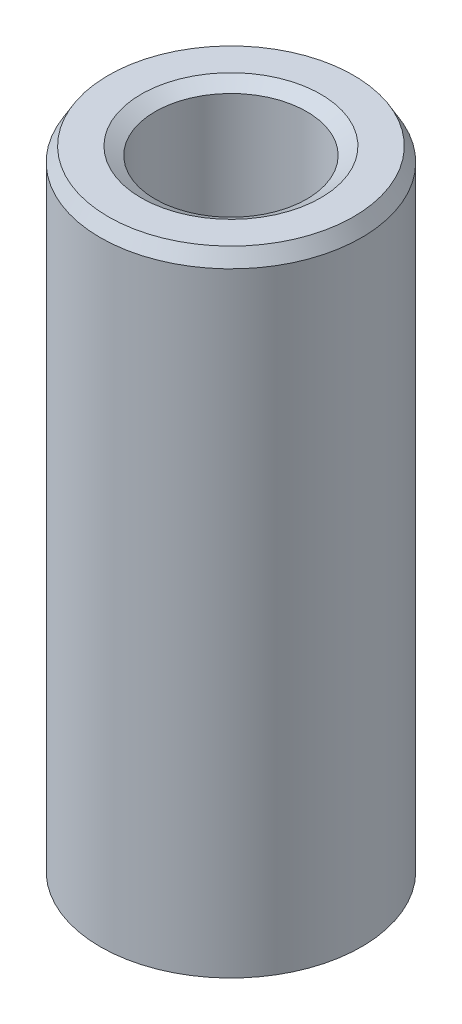
from build123d import *
from OCP.BRepFilletAPI import BRepFilletAPI_MakeChamfer

# Parameters (mm, degrees)
SKETCH1_R           = 32.5
BOSS_EXTRUDE1_DEPTH = 158.247798565
SKETCH2_R           = 18.861884047
CUT_EXTRUDE1_DEPTH  = 165.787334922
CHAMFER1_SIZE       = 3.479317011
CHAMFER1_SIZE2      = 2.008784613


with BuildPart() as part:
    # Sketch1 → Boss-Extrude1 (new body)
    with BuildSketch(Plane(origin=(0, 0, 0), x_dir=(1, 0, 0), z_dir=(0, 1, 0))):
        Circle(SKETCH1_R)
    extrude(amount=BOSS_EXTRUDE1_DEPTH)

    # Sketch2 → Cut-Extrude1 (cut, through all)
    with BuildSketch(Plane(origin=(0, 0, 0), x_dir=(1, 0, 0), z_dir=(0, 1, 0))):
        Circle(SKETCH2_R)
    extrude(amount=CUT_EXTRUDE1_DEPTH, mode=Mode.SUBTRACT)

    # Chamfer1: one chamfer whose edges measure the first distance from different faces: ONE call of the kernel's chamfer builder (chamfer() names one face for all edges)
    chamfer1_edges_1 = [part.edges().sort_by_distance(p)[0] for p in [
        (-18.861884047, 158.247798565, 0),
    ]]
    chamfer1_side_1 = [part.faces().sort_by_distance(p)[0] for p in [
        (-31.580761184, 158.247798565, 0),
    ]]
    chamfer1_edges_2 = [part.edges().sort_by_distance(p)[0] for p in [
        (-18.861884047, 0, 0),
    ]]
    chamfer1_side_2 = [part.faces().sort_by_distance(p)[0] for p in [
        (-18.861884047, 79.123899283, 0),
    ]]
    chamfer1_edges_3 = [part.edges().sort_by_distance(p)[0] for p in [
        (-32.5, 0, 0),
    ]]
    chamfer1_side_3 = [part.faces().sort_by_distance(p)[0] for p in [
        (-31.580761184, 0, 0),
    ]]
    chamfer1_edges_4 = [part.edges().sort_by_distance(p)[0] for p in [
        (-32.5, 158.247798565, 0),
    ]]
    chamfer1_side_4 = [part.faces().sort_by_distance(p)[0] for p in [
        (-32.5, 79.123899283, 0),
    ]]
    chamfer1 = BRepFilletAPI_MakeChamfer(part.part.solid().wrapped)
    for e in chamfer1_edges_1:
        chamfer1.Add(CHAMFER1_SIZE, CHAMFER1_SIZE2, e.wrapped, chamfer1_side_1[0].wrapped)  # the first distance lies on this face
    for e in chamfer1_edges_2:
        chamfer1.Add(CHAMFER1_SIZE, CHAMFER1_SIZE2, e.wrapped, chamfer1_side_2[0].wrapped)  # the first distance lies on this face
    for e in chamfer1_edges_3:
        chamfer1.Add(CHAMFER1_SIZE, CHAMFER1_SIZE2, e.wrapped, chamfer1_side_3[0].wrapped)  # the first distance lies on this face
    for e in chamfer1_edges_4:
        chamfer1.Add(CHAMFER1_SIZE, CHAMFER1_SIZE2, e.wrapped, chamfer1_side_4[0].wrapped)  # the first distance lies on this face
    add(Compound.cast(chamfer1.Shape()), mode=Mode.REPLACE)


solid = part.part
